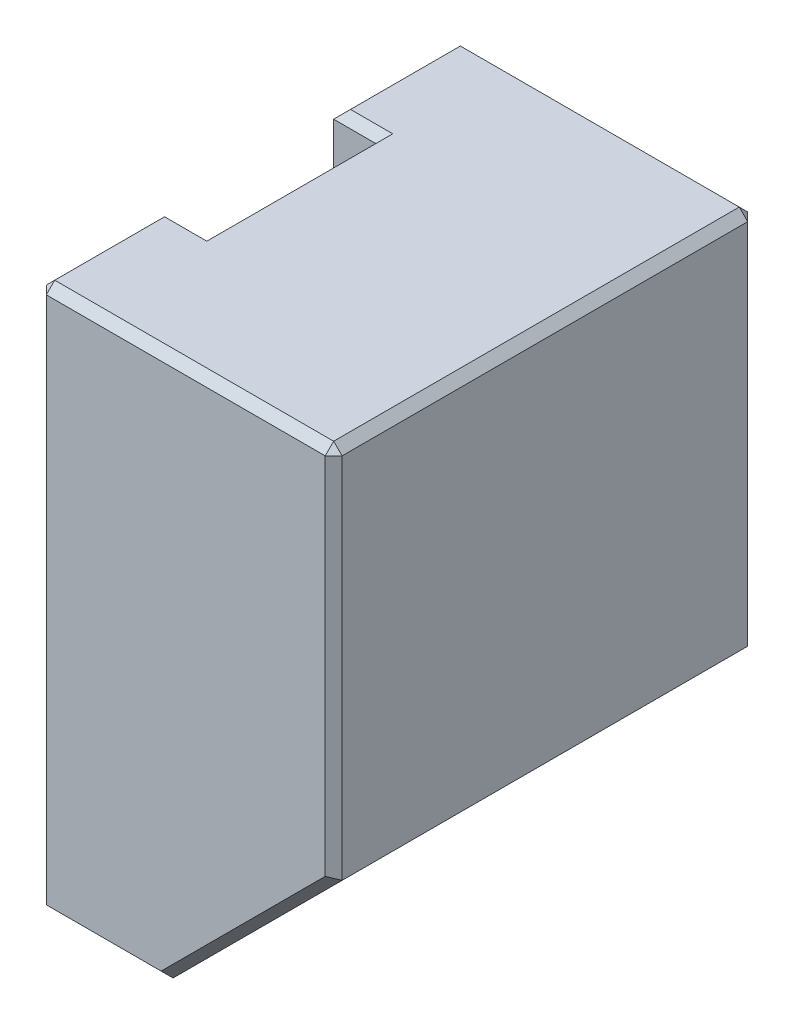
from build123d import *

# Parameters (mm, degrees)
SKETCH1_W           = 35
SKETCH1_H           = 49.99
BOSS_EXTRUDE1_DEPTH = 64.5
CUT_EXTRUDE1_REACH  = 85.46
CUT_EXTRUDE2_REACH  = 79.524
SKETCH3_W           = 14
SKETCH3_H           = 20
FILLET1_R           = 7
SKETCH4_W           = 5
SKETCH4_H           = 20
CUT_EXTRUDE3_DEPTH  = 43
SKETCH5_W           = 30
SKETCH5_H           = 5
CUT_EXTRUDE4_DEPTH  = 5
FILLET5_R           = 2.5
FILLET6_R           = 2.5
CHAMFER1_SIZE       = 1


with BuildPart() as part:
    # Sketch1 → Boss-Extrude1 (new body)
    with BuildSketch(Plane(origin=(0, 0, 0), x_dir=(1, 0, 0), z_dir=(0, 1, 0))):
        Rectangle(SKETCH1_W, SKETCH1_H)
    extrude(amount=-BOSS_EXTRUDE1_DEPTH)

    # Sketch2 → Cut-Extrude1 (cut, up to next)
    with BuildSketch(Plane.XY.offset(24.995), mode=Mode.PRIVATE) as cut_extrude1_sk1:
        Polygon((-2.5, -64.5), (17.5, -44.5), (17.5, -64.5), align=None)
    cut_extrude1_tool1 = extrude(cut_extrude1_sk1.sketch, amount=-CUT_EXTRUDE1_REACH, mode=Mode.PRIVATE) & part.part
    add(cut_extrude1_tool1.solids().sort_by_distance((10.833333, -57.833333, 24.995))[0], mode=Mode.SUBTRACT)

    # Sketch3 → Cut-Extrude2 (cut, up to next)
    with BuildSketch(Plane.ZY.offset(17.5), mode=Mode.PRIVATE) as cut_extrude2_sk1:
        with Locations((0, -54.5)):
            Rectangle(SKETCH3_W, SKETCH3_H)
    cut_extrude2_tool1 = extrude(cut_extrude2_sk1.sketch, amount=-CUT_EXTRUDE2_REACH, mode=Mode.PRIVATE) & part.part
    add(cut_extrude2_tool1.solids().sort_by_distance((-17.5, -54.5, 0))[0], mode=Mode.SUBTRACT)

    # Fillet1
    fillet1_edges = [part.edges().sort_by_distance(p)[0] for p in [
        (0, -44.5, -7),
        (0, -44.5, 7),
    ]]
    fillet(fillet1_edges, radius=FILLET1_R - 0.0001)  # a hair under: the kernel refuses the full size

    # Sketch4 → Cut-Extrude3 (cut)
    with BuildSketch(Plane(origin=(0, 0, 0), x_dir=(1, 0, 0), z_dir=(0, 1, 0))):
        with Locations((-15, 0)):
            Rectangle(SKETCH4_W, SKETCH4_H)
    extrude(amount=-CUT_EXTRUDE3_DEPTH, mode=Mode.SUBTRACT)

    # Sketch5 → Cut-Extrude4 (cut)
    with BuildSketch(Plane.ZY.offset(17.5)):
        with Locations((0, -40.5)):
            Rectangle(SKETCH5_W, SKETCH5_H)
    extrude(amount=-CUT_EXTRUDE4_DEPTH, mode=Mode.SUBTRACT)

    # Fillet5
    fillet5_edges = [part.edges().sort_by_distance(p)[0] for p in [
        (-15, -38, -15),
        (-15, -43, -15),
    ]]
    fillet(fillet5_edges, radius=FILLET5_R - 0.0001)  # a hair under: the kernel refuses the full size

    # Fillet6
    fillet6_edges = [part.edges().sort_by_distance(p)[0] for p in [
        (-15, -43, 15),
        (-15, -38, 15),
    ]]
    fillet(fillet6_edges, radius=FILLET6_R - 0.0001)  # a hair under: the kernel refuses the full size

    # Chamfer1
    chamfer1_edges = [part.edges().sort_by_distance(p)[0] for p in [
        (-10, -64.5, -24.995),
        (17.5, -22.25, -24.995),
        (17.5, -22.25, 24.995),
        (-10, -64.5, 24.995),
        (7.5, -54.5, -24.995),
        (7.5, -54.5, 24.995),
        (0, 0, 24.995),
        (-17.5, 0, -17.4975),
        (-17.5, 0, 17.4975),
        (0, 0, -24.995),
        (17.5, 0, 0),
        (-15, 0, 10),
        (-12.5, 0, 0),
        (-15, 0, -10),
        (-17.5, -32.25, 24.995),
        (-17.5, -32.25, -24.995),
    ]]
    chamfer(chamfer1_edges, length=CHAMFER1_SIZE)


solid = part.part
